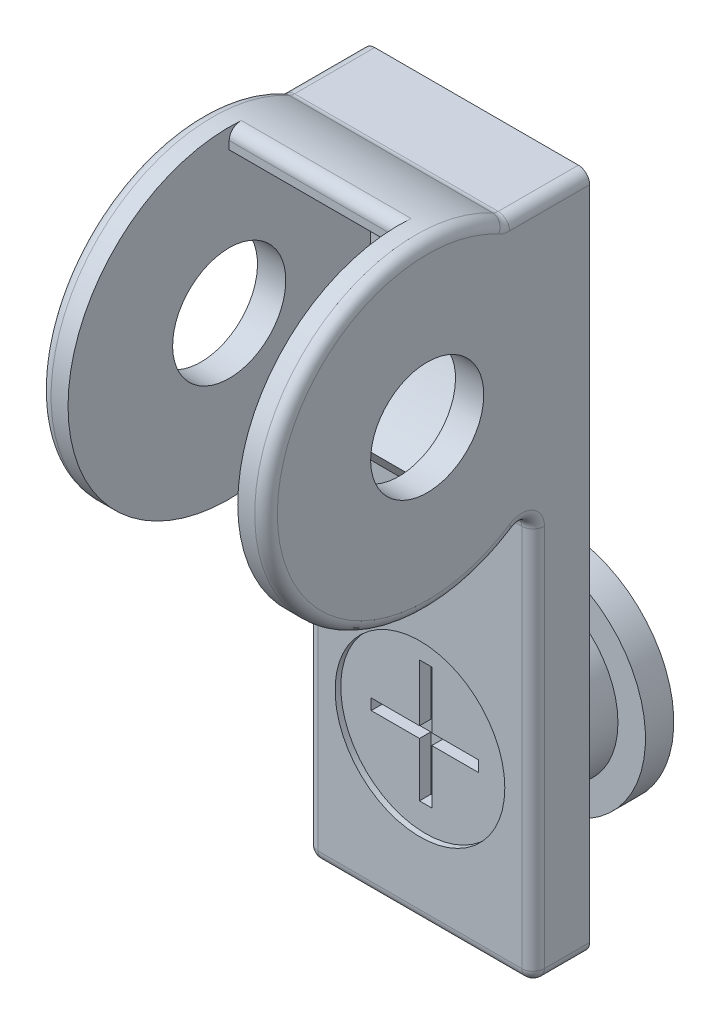
from build123d import *

# Parameters (mm, degrees)
SKETCH1_W           = 4
SKETCH1_H           = 15
BOSS_EXTRUDE1_DEPTH = 1
SKETCH2_R           = 1.5
CUT_EXTRUDE1_DEPTH  = 0.1
CUT_EXTRUDE2_DEPTH  = 0.2
SKETCH4_R           = 2.849028986
BOSS_EXTRUDE2_DEPTH = 4
CUT_EXTRUDE3_START  = -0.5
CUT_EXTRUDE3_DEPTH  = 3
SKETCH6_R           = 1
CUT_EXTRUDE4_DEPTH  = 50.5
BOSS_EXTRUDE3_REACH = 11.393
SKETCH7_W           = 4
SKETCH7_H           = 0.331547144
SKETCH8_R           = 1.5
BOSS_EXTRUDE4_DEPTH = 1.5
SKETCH13_R          = 2.5
CUT_EXTRUDE6_DEPTH  = 3
SKETCH14_R          = 1.5
BOSS_EXTRUDE5_DEPTH = 1
SKETCH15_R          = 1.65511662
CUT_EXTRUDE7_DEPTH  = 1.5
SKETCH16_W          = 5.099694499
SKETCH16_H          = 2.218752709
CUT_EXTRUDE8_DEPTH  = 3
FILLET1_R           = 0.2
SKETCH17_R          = 1.288740584
BOSS_EXTRUDE6_DEPTH = 1
FILLET2_R           = 1
SKETCH18_R          = 1.986595171
BOSS_EXTRUDE7_DEPTH = 0.5


with BuildPart() as part:
    # Sketch1 → Boss-Extrude1 (new body)
    with BuildSketch(Plane.XY):
        Rectangle(SKETCH1_W, SKETCH1_H)
    extrude(amount=BOSS_EXTRUDE1_DEPTH)

    # Sketch2 → Cut-Extrude1 (cut)
    with BuildSketch(Plane.XY.offset(1)):
        with Locations((0, -5.001272615)):
            Circle(SKETCH2_R)
        with Locations((0, -1.683913286)):
            Circle(SKETCH2_R)
    extrude(amount=-CUT_EXTRUDE1_DEPTH, mode=Mode.SUBTRACT)

    # Sketch3 → Cut-Extrude2 (cut)
    with BuildSketch(Plane.XY.offset(0.9)):
        Polygon((-0.108557852, -6.107102786), (0.108557852, -6.107102786), (0.108557852, -5.098298557), (0.933492592, -5.098298557), (0.933492592, -4.904246673), (0.108557852, -4.904246673), (0.108557852, -3.948637219), (-0.108557852, -3.948637219), (-0.108557852, -4.904246673), (-0.962043741, -4.904246673), (-0.962043741, -5.098298557), (-0.108557852, -5.098298557), align=None)
        Polygon((-0.962043741, -1.780939228), (-0.962043741, -1.586887344), (-0.108557852, -1.586887344), (-0.108557852, -0.578083116), (0.108557852, -0.578083116), (0.108557852, -1.586887344), (0.933492592, -1.586887344), (0.933492592, -1.780939228), (0.108557852, -1.780939228), (0.108557852, -2.736548682), (-0.108557852, -2.736548682), (-0.108557852, -1.780939228), align=None)
    extrude(amount=-CUT_EXTRUDE2_DEPTH, mode=Mode.SUBTRACT)

    # Sketch4 → Boss-Extrude2 (add)
    with BuildSketch(Plane(origin=(2, 0, 0), x_dir=(0, 0, -1), z_dir=(1, 0, 0))):
        with Locations((-2.871998104, 5.020758916)):
            Circle(SKETCH4_R)
    extrude(amount=-BOSS_EXTRUDE2_DEPTH)

    # Sketch5 → Cut-Extrude3 (cut)
    with BuildSketch(Plane(origin=(2, 0, 0), x_dir=(0, 0, -1), z_dir=(1, 0, 0)).offset(CUT_EXTRUDE3_START)):
        with BuildLine():
            Line((-2.871998104, 7.200015745), (-2.871998104, 9.297132531))
            Line((-2.871998104, 9.297132531), (-14.767112772, 7.450442617))
            Line((-14.767112772, 7.450442617), (-10.359701014, 0.939041163))
            Line((-10.359701014, 0.939041163), (-1.261981382, 2.30327176))
            Line((-1.261981382, 2.30327176), (-1.761184463, 3.145858016))
            ThreePointArc((-1.761184463, 3.145858016), (-0.770207092, 5.596636393), (-2.871998104, 7.200015745))
        make_face()
    extrude(amount=-CUT_EXTRUDE3_DEPTH, mode=Mode.SUBTRACT)

    # Sketch6 → Cut-Extrude4 (cut)
    with BuildSketch(Plane(origin=(2, 0, 0), x_dir=(0, 0, -1), z_dir=(1, 0, 0))):
        with Locations(Location((-2.871998104, 5.020758916, 0), (0, 0, 90))):
            Circle(SKETCH6_R)
    extrude(amount=-CUT_EXTRUDE4_DEPTH, mode=Mode.SUBTRACT)

    # Sketch7 → Boss-Extrude3 (add, up to next)
    with BuildSketch(Plane.XY.offset(1), mode=Mode.PRIVATE) as boss_extrude3_sk1:
        with Locations((0, 7.334226428)):
            Rectangle(SKETCH7_W, SKETCH7_H)
    boss_extrude3_tool1 = extrude(boss_extrude3_sk1.sketch, amount=BOSS_EXTRUDE3_REACH, mode=Mode.PRIVATE) - part.part
    add(boss_extrude3_tool1.solids().sort_by_distance((0, 7.334226, 1))[0])

    # Sketch8 → Boss-Extrude4 (add)
    with BuildSketch(Plane(origin=(0, 0, 0), x_dir=(-1, 0, 0), z_dir=(0, 0, -1))):
        with Locations(Location((0, -1.683913286, 0), (0, 0, 180))):
            Circle(SKETCH8_R)
        with Locations(Location((0, -5.001272615, 0), (0, 0, 180))):
            Circle(SKETCH8_R)
    extrude(amount=BOSS_EXTRUDE4_DEPTH)

    # Sketch13 → Cut-Extrude6 (cut)
    with BuildSketch(Plane(origin=(-1.5, 0, 0), x_dir=(0, 0, -1), z_dir=(1, 0, 0))):
        with Locations((-2.871998104, 5.020758916)):
            Circle(SKETCH13_R)
    extrude(amount=CUT_EXTRUDE6_DEPTH, mode=Mode.SUBTRACT)

    # Sketch14 → Boss-Extrude5 (add)
    with BuildSketch(Plane.XY.offset(1)):
        with Locations((0, -5.001272615)):
            Circle(SKETCH14_R)
    extrude(amount=-BOSS_EXTRUDE5_DEPTH)

    # Sketch15 → Cut-Extrude7 (cut)
    with BuildSketch(Plane(origin=(0, 0, -1.5), x_dir=(-1, 0, 0), z_dir=(0, 0, -1))):
        with Locations((0, -5.001272615)):
            Circle(SKETCH15_R)
    extrude(amount=-CUT_EXTRUDE7_DEPTH, mode=Mode.SUBTRACT)

    # Sketch16 → Cut-Extrude8 (cut)
    with BuildSketch(Plane.XZ.offset(7.5)):
        with Locations((0.205566766, 0.392687456)):
            Rectangle(SKETCH16_W, SKETCH16_H)
    extrude(amount=-CUT_EXTRUDE8_DEPTH, mode=Mode.SUBTRACT)

    # Fillet1
    fillet1_edges = [part.edges().sort_by_distance(p)[0] for p in [
        (0, 7.869787902, 2.871998104),
        (2, 4.733861171, 5.706544954),
        (0, 7.5, 1.468313735),
        (2, -0.813467512, 1),
        (-2, -4.5, 0.5),
        (2, -4.5, 0.5),
        (0, -4.5, 1),
        (-2, 7.5, 0.734156868),
        (2, 7.5, 0.734156868),
        (-2, -0.813467512, 1),
        (0, 2.873064976, 1),
        (-2, 4.733861171, 5.706544954),
    ]]
    fillet(fillet1_edges, radius=FILLET1_R)

    # Sketch17 → Boss-Extrude6 (add)
    with BuildSketch(Plane(origin=(0, 0, 0), x_dir=(-1, 0, 0), z_dir=(0, 0, -1))):
        with Locations(Location((0, 4.363041625, 0), (0, 0, 180))):
            Circle(SKETCH17_R)
    extrude(amount=BOSS_EXTRUDE6_DEPTH)

    # Fillet2
    fillet2_edges = [part.edges().sort_by_distance(p)[0] for p in [
        (-1.288740584, 4.363041625, -1),
    ]]
    fillet(fillet2_edges, radius=FILLET2_R - 0.0001)  # a hair under: the kernel refuses the full size

    # Sketch18 → Boss-Extrude7 (add)
    with BuildSketch(Plane(origin=(0, 0, -1.5), x_dir=(-1, 0, 0), z_dir=(0, 0, -1))):
        with Locations((0, -1.683913286)):
            Circle(SKETCH18_R)
    extrude(amount=-BOSS_EXTRUDE7_DEPTH)


solid = part.part
